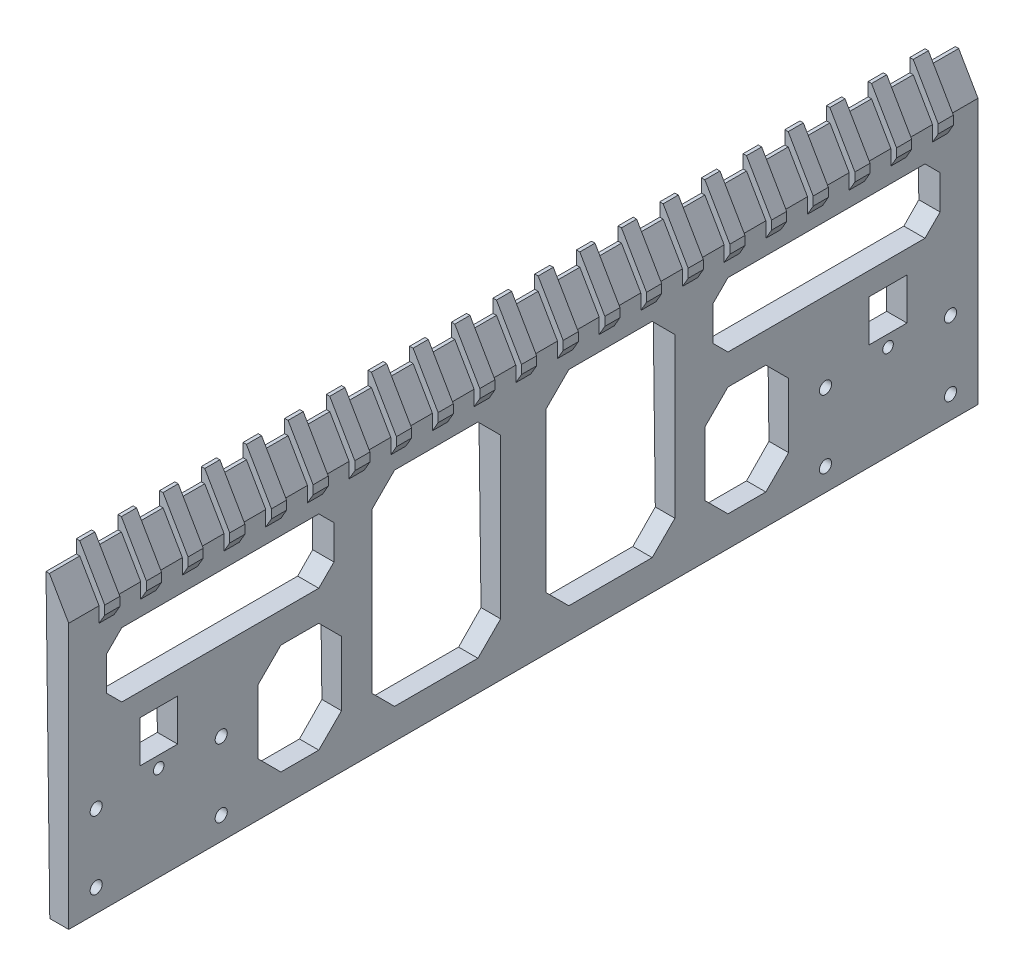
from build123d import *

# Parameters (mm, degrees)
SKETCH_1_W                  = 240
SKETCH_1_H                  = 70
EXTRUDE_1_DEPTH             = 6
CUT_EXTRUDE_2_DEPTH         = 251.071989635
EXTRUDE_2_DEPTH             = 240
EXTRUDE_3_DEPTH             = 2
PATTERN_LINEAR_1_COUNT      = 11
PATTERN_LINEAR_1_PITCH      = 11
PATTERN_LINEAR_1_COUNT_DIR2 = 11
PATTERN_LINEAR_1_PITCH_DIR2 = 11
HOLE_WIZARD_1_D             = 3.2
HOLE_WIZARD_1_CBORE_D       = 6
HOLE_WIZARD_1_CBORE_DEPTH   = 3.4
SKETCH_16_R                 = 1.4
CUT_EXTRUDE_3_DEPTH         = 10
SKETCH_17_W                 = 10
SKETCH_17_H                 = 11
CUT_EXTRUDE_4_DEPTH         = 251.112474699
CUT_EXTRUDE_5_REACH         = 252.112


with BuildPart() as part:
    # 草图1 → 凸台-拉伸1 (new body)
    with BuildSketch(Plane(origin=(0, 0, 0), x_dir=(0, 0, -1), z_dir=(1, 0, 0))):
        with Locations((120, -35)):
            Rectangle(SKETCH_1_W, SKETCH_1_H)
    extrude(amount=EXTRUDE_1_DEPTH)

    # 草图3 → 切除-拉伸2 (cut, through all)
    with BuildSketch(Plane(origin=(6, 0, 0), x_dir=(0, 0, -1), z_dir=(1, 0, 0))):
        Polygon((14, -8), (66, -8), (70, -12), (70, -21), (66, -25), (14, -25), (10, -21), (10, -12), align=None)
        Polygon((80, -14), (86, -8), (108, -8), (114, -14), (114, -56), (108, -62), (86, -62), (80, -56), align=None)
        Polygon((50, -56), (56, -62), (66, -62), (72, -56), (72, -39), (66, -33), (56, -33), (50, -39), align=None)
    cut_extrude_2 = extrude(amount=-CUT_EXTRUDE_2_DEPTH, mode=Mode.SUBTRACT)

    # 草图6 → 凸台-拉伸2 (add)
    with BuildSketch(Plane.XY):
        Polygon((6, 0), (0, 0), (0, 8.833459119), (0.9, 8.833459119), align=None)
    extrude(amount=-EXTRUDE_2_DEPTH)

    # 草图8 → 凸台-拉伸3 (add, symmetric)
    with BuildSketch(Plane.XY.offset(-120)):
        Polygon((0, 10.392304845), (0, 12.333459119), (0.9, 12.333459119), (7.5, 0.901923789), (7.5, -1.401923789), (6, -4), (6, 0), (0.9, 8.833459119), (0, 8.833459119), align=None)
    extrude_3 = extrude(amount=EXTRUDE_3_DEPTH, both=True)

    # 阵列(线性)1: Extrude 3 11 × 11
    with Locations(*[Vector(0, 0, 1) * (i * PATTERN_LINEAR_1_PITCH) + Vector(0, 0, -1) * (j * PATTERN_LINEAR_1_PITCH_DIR2) for i in range(PATTERN_LINEAR_1_COUNT) for j in range(PATTERN_LINEAR_1_COUNT_DIR2) if (i, j) != (0, 0)]):
        add(extrude_3)

    # 打孔尺寸(%根据)内六角圆柱头螺钉的类型1 (through all)
    with Locations(Plane.ZY):
        with Locations((-40.25, -46), (-7.25, -46), (-7.25, -64), (-40.25, -64)):
            hole_wizard_1 = CounterBoreHole(HOLE_WIZARD_1_D / 2, HOLE_WIZARD_1_CBORE_D / 2, HOLE_WIZARD_1_CBORE_DEPTH)

    # 草图16 → 切除-拉伸3 (cut)
    with BuildSketch(Plane.ZY):
        with Locations((-23.75, -45)):
            Circle(SKETCH_16_R)
    cut_extrude_3 = extrude(amount=-CUT_EXTRUDE_3_DEPTH, mode=Mode.SUBTRACT)

    # 镜向1: 打孔尺寸(%根据)内六角圆柱头螺钉的类型1 across plane
    add(hole_wizard_1.mirror(Plane.XY.offset(-120)), mode=Mode.SUBTRACT)

    # 镜向2: 切除-拉伸2, 切除-拉伸3 across plane
    add(cut_extrude_2.mirror(Plane.XY.offset(-120)), mode=Mode.SUBTRACT)
    add(cut_extrude_3.mirror(Plane.XY.offset(-120)), mode=Mode.SUBTRACT)

    # 草图17 → 切除-拉伸4 (cut, through all)
    with BuildSketch(Plane.ZY):
        with Locations((-23.75, -36.5)):
            Rectangle(SKETCH_17_W, SKETCH_17_H)
        with Locations((-216.25, -36.5)):
            Rectangle(SKETCH_17_W, SKETCH_17_H)
    extrude(amount=-CUT_EXTRUDE_4_DEPTH, mode=Mode.SUBTRACT)

    # 草图18 → 切除-拉伸5 (cut, up to next)
    with BuildSketch(Plane.XY, mode=Mode.PRIVATE) as cut_extrude_5_sk1:
        Polygon((0, -70), (1, -70), (0, 8.833459119), align=None)
    cut_extrude_5_tool1 = extrude(cut_extrude_5_sk1.sketch, amount=-CUT_EXTRUDE_5_REACH, mode=Mode.PRIVATE) & part.part
    add(cut_extrude_5_tool1.solids().sort_by_distance((0.333333, -43.72218, 0))[0], mode=Mode.SUBTRACT)


solid = part.part
